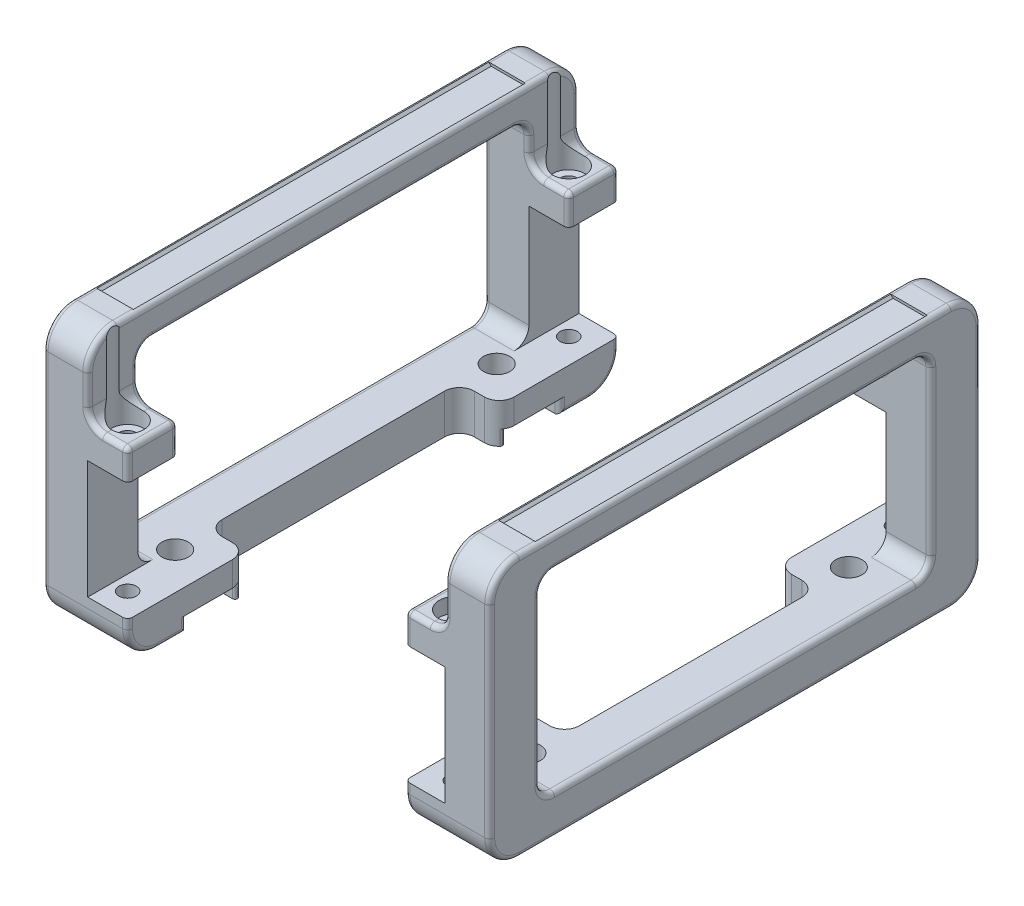
from build123d import *

# Parameters (mm, degrees)
EXTRUDE_1_DEPTH          = 49.5
EXTRUDE_1_DEPTH_BACK     = 49.5
SKETCH_3_W               = 9
SKETCH_3_H               = 23.8
SKETCH_4_W               = 9
SKETCH_4_H               = 10.1
SKETCH_4_H_2             = 78.8
SKETCH_4_W_2             = 8.03
SKETCH_4_R               = 1.75
EXTRUDE_2_DEPTH          = 6
MOVE_START               = -19.9
MOVE_FACE_1_OUTLINE_R    = 1.75
MOVE_FACE_1_DEPTH        = 2
SKETCH_5_W               = 99
SKETCH_5_H               = 15
EXTRUDE_2010_DEPTH       = 9
SKETCH_6_W               = 78.8
SKETCH_6_H               = 38.8
CUT_EXTRUDE_1_DEPTH      = 62.827832729
EXTRUDE_START            = -8
SKETCH_10_W              = 8.03
SKETCH_10_H              = 14
EXTRUDE_4_DEPTH          = 8
SKETCH_11_R              = 5.2
CUT_EXTRUDE_4_DEPTH      = 3
SKETCH_12_R              = 2.65
CUT_EXTRUDE_5_DEPTH      = 81.51266981
SKETCH_13_W              = 6.4
SKETCH_13_H              = 79
CUT_EXTRUDE_6_DEPTH      = 0.5
FILLET_START             = -46
FILLET_1_DEPTH           = 18.03
FILLET_2_R               = 3
FILLET_5_R               = 3
FILLET_3_R               = 1
FILLET_6_R               = 0.5
CUT_EXTRUDE_2_DEPTH      = 77.838076612
CUT_EXTRUDE_2_DEPTH_BACK = 3
SKETCH_8_R               = 3.25
CUT_EXTRUDE_START        = -5
SKETCH_9_R               = 3.25
CUT_EXTRUDE_3_DEPTH      = 5
CHAMFER_1_SIZE           = 0.5


with BuildPart() as part:
    # ｽｹｯﾁ3 → ﾎﾞｽ - 押し出し1 (new, two sides: drawn at the far end of the back side and taken through both)
    with BuildSketch(Plane.XY.offset(-EXTRUDE_1_DEPTH_BACK)):
        with Locations((-40.5, 0)):
            Rectangle(SKETCH_3_W, SKETCH_3_H)
    extrude(amount=EXTRUDE_1_DEPTH + EXTRUDE_1_DEPTH_BACK)

    # ｽｹｯﾁ4 → ﾎﾞｽ - 押し出し2 (add)
    # profile 1 of 5: a face of its own
    with BuildSketch(Plane(origin=(0, 11.9, 0), x_dir=(1, 0, 0), z_dir=(0, 1, 0))):
        with Locations((-40.5, 44.45)):
            Rectangle(SKETCH_4_W, SKETCH_4_H)
    # profile 2 of 5: a face of its own
    with BuildSketch(Plane(origin=(0, 11.9, 0), x_dir=(1, 0, 0), z_dir=(0, 1, 0))):
        with Locations((-40.5, 0)):
            Rectangle(SKETCH_4_W, SKETCH_4_H_2)
    # profile 3 of 5: a face of its own
    with BuildSketch(Plane(origin=(0, 11.9, 0), x_dir=(1, 0, 0), z_dir=(0, 1, 0))):
        with Locations((-40.5, -44.45)):
            Rectangle(SKETCH_4_W, SKETCH_4_H)
    # profile 4 of 5: a face of its own
    with BuildSketch(Plane(origin=(0, 11.9, 0), x_dir=(1, 0, 0), z_dir=(0, 1, 0))):
        with Locations((-31.985, 44.45)):
            Rectangle(SKETCH_4_W_2, SKETCH_4_H)
        with Locations(Location((-33.02, 44.45, 0), (0, 0, 180))):
            Circle(SKETCH_4_R, mode=Mode.SUBTRACT)
    # profile 5 of 5: a face of its own
    with BuildSketch(Plane(origin=(0, 11.9, 0), x_dir=(1, 0, 0), z_dir=(0, 1, 0))):
        with Locations((-31.985, -44.45)):
            Rectangle(SKETCH_4_W_2, SKETCH_4_H)
        with Locations(Location((-33.02, -44.45, 0), (0, 0, 180))):
            Circle(SKETCH_4_R, mode=Mode.SUBTRACT)
    extrude_2 = extrude(amount=EXTRUDE_2_DEPTH)

    # ﾐﾗｰ1: ﾎﾞｽ - 押し出し2 across plane
    add(extrude_2.mirror(Plane.ZX))

    # Move Face 1: read off the stored shape, not the designer's step
    # Move Face 1 outline → Move Face 1 (add)
    with BuildSketch(Plane(origin=(0, 0, 0), x_dir=(1, 0, 0), z_dir=(0, 1, 0)).offset(MOVE_START)):
        Polygon((-27.97, 39.4), (-27.97, 49.5), (-45, 49.5), (-45, -49.5), (-27.97, -49.5), (-27.97, -39.4), (-36, -39.4), (-36, 39.4), align=None)
        with Locations((-33.02, 44.45)):
            Circle(MOVE_FACE_1_OUTLINE_R, mode=Mode.SUBTRACT)
        with Locations((-33.02, -44.45)):
            Circle(MOVE_FACE_1_OUTLINE_R, mode=Mode.SUBTRACT)
    extrude(amount=MOVE_FACE_1_DEPTH)

    # ｽｹｯﾁ5 → Extrude 2010 (add)
    with BuildSketch(Plane.ZY.offset(45)):
        with Locations((0, 25.4)):
            Rectangle(SKETCH_5_W, SKETCH_5_H)
    extrude(amount=-EXTRUDE_2010_DEPTH)

    # ｽｹｯﾁ6 → ｶｯﾄ - 押し出し1 (cut, through all)
    with BuildSketch(Plane.ZY.offset(45)):
        with Locations((0, 7.5)):
            Rectangle(SKETCH_6_W, SKETCH_6_H)
    extrude(amount=-CUT_EXTRUDE_1_DEPTH, mode=Mode.SUBTRACT)

    # ｽｹｯﾁ10 → ﾎﾞｽ - 押し出し4 (add)
    with BuildSketch(Plane.XZ.offset(19.9).offset(EXTRUDE_START)):
        with Locations((-31.985, -32.4)):
            Rectangle(SKETCH_10_W, SKETCH_10_H)
        with Locations((-31.985, 32.4)):
            Rectangle(SKETCH_10_W, SKETCH_10_H)
    extrude(amount=EXTRUDE_4_DEPTH)

    # ｽｹｯﾁ11 → ｶｯﾄ - 押し出し4 (cut)
    with BuildSketch(Plane.XZ.offset(19.9)):
        with BuildLine():
            ThreePointArc((-30.285, -32.4), (-31.808044738, -36.076955262), (-35.485, -37.6))
            Line((-35.485, -37.6), (-27.97, -37.6))
            Line((-27.97, -37.6), (-27.97, -27.2))
            Line((-27.97, -27.2), (-35.485, -27.2))
            ThreePointArc((-35.485, -27.2), (-31.808044738, -28.723044738), (-30.285, -32.4))
        make_face()
        with BuildLine():
            ThreePointArc((-35.485, -27.2), (-40.685, -32.4), (-35.485, -37.6))
            Line((-35.485, -37.6), (-35.485, -27.2))
        make_face()
        with BuildLine():
            Line((-35.485, -27.2), (-35.485, -37.6))
            ThreePointArc((-35.485, -37.6), (-31.808044738, -36.076955262), (-30.285, -32.4))
            ThreePointArc((-30.285, -32.4), (-31.808044738, -28.723044738), (-35.485, -27.2))
        make_face()
        with Locations((-35.485, 32.4)):
            Circle(SKETCH_11_R)
        with BuildLine():
            ThreePointArc((-30.285, 32.4), (-31.808044738, 36.076955262), (-35.485, 37.6))
            Line((-35.485, 37.6), (-35.485, 27.2))
            ThreePointArc((-35.485, 27.2), (-31.808044738, 28.723044738), (-30.285, 32.4))
        make_face()
        with BuildLine():
            Line((-35.485, 27.2), (-35.485, 37.6))
            ThreePointArc((-35.485, 37.6), (-40.685, 32.4), (-35.485, 27.2))
        make_face()
        with BuildLine():
            Line((-27.97, 37.6), (-35.485, 37.6))
            ThreePointArc((-35.485, 37.6), (-31.808044738, 36.076955262), (-30.285, 32.4))
            ThreePointArc((-30.285, 32.4), (-31.808044738, 28.723044738), (-35.485, 27.2))
            Line((-35.485, 27.2), (-27.97, 27.2))
            Line((-27.97, 27.2), (-27.97, 37.6))
        make_face()
    extrude(amount=-CUT_EXTRUDE_4_DEPTH, mode=Mode.SUBTRACT)

    # ｽｹｯﾁ12 → ｶｯﾄ - 押し出し5 (cut, through all)
    with BuildSketch(Plane(origin=(0, -11.9, 0), x_dir=(1, 0, 0), z_dir=(0, 1, 0))):
        with Locations(Location((-35.485, -32.4, 0), (0, 0, 180))):
            Circle(SKETCH_12_R)
        with Locations(Location((-35.485, 32.4, 0), (0, 0, 180))):
            Circle(SKETCH_12_R)
    extrude(amount=-CUT_EXTRUDE_5_DEPTH, mode=Mode.SUBTRACT)

    # ｽｹｯﾁ13 → ｶｯﾄ - 押し出し6 (cut)
    with BuildSketch(Plane(origin=(0, 32.9, 0), x_dir=(1, 0, 0), z_dir=(0, 1, 0))):
        with Locations((-40.5, 0)):
            Rectangle(SKETCH_13_W, SKETCH_13_H)
    extrude(amount=-CUT_EXTRUDE_6_DEPTH, mode=Mode.SUBTRACT)

    # ﾌｨﾚｯﾄ1: read off the stored shape, not the designer's step
    # ﾌｨﾚｯﾄ1 outline → ﾌｨﾚｯﾄ1 (cut)
    with BuildSketch(Plane.YZ.offset(FILLET_START)):
        with BuildLine():
            ThreePointArc((-13.9, -49.5), (-18.142640687, -47.742640687), (-19.9, -43.5))
            Line((-19.9, -43.5), (-19.9, -49.5))
            Line((-19.9, -49.5), (-13.9, -49.5))
        make_face()
        with BuildLine():
            Line((-19.9, 49.5), (-19.9, 43.5))
            ThreePointArc((-19.9, 43.5), (-18.142640687, 47.742640687), (-13.9, 49.5))
            Line((-13.9, 49.5), (-19.9, 49.5))
        make_face()
        with BuildLine():
            ThreePointArc((32.9, -43.5), (31.142640687, -47.742640687), (26.9, -49.5))
            Line((26.9, -49.5), (32.9, -49.5))
            Line((32.9, -49.5), (32.9, -43.5))
        make_face()
        with BuildLine():
            Line((32.9, 49.5), (26.9, 49.5))
            ThreePointArc((26.9, 49.5), (31.142640687, 47.742640687), (32.9, 43.5))
            Line((32.9, 43.5), (32.9, 49.5))
        make_face()
    extrude(amount=FILLET_1_DEPTH, mode=Mode.SUBTRACT)

    # ﾌｨﾚｯﾄ2
    # the kernel refuses this fillet: 3 mm, written as the material it adds along each edge
    with BuildSketch(Plane(origin=(-36, 17.9, -49.5), x_dir=(1, 0, 0), z_dir=(0, 0, 1))) as fillet_2_piece_1_section:
        with BuildLine():
            CenterArc((FILLET_2_R, FILLET_2_R), FILLET_2_R, 180, 90)
            Line((0, FILLET_2_R), (0, 0))
            Line((0, 0), (FILLET_2_R, 0))
        make_face()
    fillet_2_piece_1 = extrude(amount=10.1, mode=Mode.PRIVATE)
    fillet_2_piece_1 = fillet_2_piece_1 - Plane(origin=(-33.02, 17.9, -44.45), x_dir=(-1, 0, 0), z_dir=(0, -1, 0)) * Cylinder(1.75, 33, mode=Mode.PRIVATE)
    add(fillet_2_piece_1)
    with BuildSketch(Plane(origin=(-36, 17.9, 39.4), x_dir=(0, 1, 0), z_dir=(0, 0, 1))) as fillet_2_piece_2_section:
        with BuildLine():
            CenterArc((FILLET_2_R, -FILLET_2_R), FILLET_2_R, 90, 90)
            Line((0, -FILLET_2_R), (0, 0))
            Line((0, 0), (FILLET_2_R, 0))
        make_face()
    fillet_2_piece_2 = extrude(amount=10.1, mode=Mode.PRIVATE)
    fillet_2_piece_2 = fillet_2_piece_2 - Plane(origin=(-33.02, 17.9, 44.45), x_dir=(-1, 0, 0), z_dir=(0, -1, 0)) * Cylinder(1.75, 33, mode=Mode.PRIVATE)
    add(fillet_2_piece_2)

    # ﾌｨﾚｯﾄ5
    fillet_5_edges = [part.edges().sort_by_distance(p)[0] for p in [
        (-40.5, 26.9, -39.4),
        (-40.5, 26.9, 39.4),
        (-40.5, -11.9, -39.4),
        (-40.5, -11.9, 39.4),
        (-36, -15.9, -25.4),
        (-36, -15.9, 25.4),
        (-27.97, -15.9, 25.4),
        (-27.97, -15.9, -25.4),
    ]]
    fillet(fillet_5_edges, radius=FILLET_5_R)

    # ﾌｨﾚｯﾄ3
    fillet_3_edges = [part.edges().sort_by_distance(p)[0] for p in [
        (-27.97, -18.4, -37.6),
        (-27.97, -18.4, 37.6),
        (-45, 6.5, -49.5),
        (-27.97, -12.9, -49.5),
        (-45, 6.5, 49.5),
        (-45, 32.9, 0),
        (-45, -19.9, 0),
        (-45, 31.142640687, 47.742640687),
        (-45, 31.142640687, -47.742640687),
        (-45, -18.142640687, 47.742640687),
        (-45, -18.142640687, -47.742640687),
        (-27.97, -19.9, 40.55),
        (-27.97, -19.9, -40.55),
        (-27.97, -18.142640687, -47.742640687),
        (-27.97, -12.9, 49.5),
        (-36, 23.9, 49.5),
        (-27.97, -18.142640687, 47.742640687),
        (-36, 32.9, 0),
        (-36, 31.142640687, 47.742640687),
        (-36, 31.142640687, -47.742640687),
        (-27.97, 14.9, 49.5),
        (-27.97, 14.9, 39.4),
        (-36, 23.9, -49.5),
        (-36, 22.4, 39.4),
        (-30.485, 17.9, 49.5),
        (-30.485, 17.9, 39.4),
        (-30.485, 17.9, -39.4),
        (-35.121320344, 18.778679656, 39.4),
        (-35.121320344, 18.778679656, 49.5),
        (-27.97, 17.9, -44.45),
        (-35.121320344, 18.778679656, -49.5),
        (-35.121320344, 18.778679656, -39.4),
        (-27.97, 14.9, -39.4),
        (-27.97, 14.9, -49.5),
        (-45, -11.9, 0),
        (-27.97, 17.9, 44.45),
        (-36, 22.4, -39.4),
        (-45, 7.5, -39.4),
        (-45, 7.5, 39.4),
        (-45, 26.9, 0),
        (-36, 26.9, 0),
        (-30.485, 17.9, -49.5),
        (-45, -11.021320344, -38.521320344),
        (-45, -11.021320344, 38.521320344),
        (-45, 26.021320344, -38.521320344),
        (-36, 26.021320344, -38.521320344),
        (-45, 26.021320344, 38.521320344),
        (-36, 26.021320344, 38.521320344),
    ]]
    fillet(fillet_3_edges, radius=FILLET_3_R)

    # ﾌｨﾚｯﾄ6
    fillet_6_edges = [part.edges().sort_by_distance(p)[0] for p in [
        (-28.220454583, -18.4, 27.2),
        (-28.220454583, -18.4, -27.2),
    ]]
    fillet(fillet_6_edges, radius=FILLET_6_R)

    # ｽｹｯﾁ8 → ｶｯﾄ - 押し出し2 (cut, two sides: drawn at the far end of the back side and taken through both)
    with BuildSketch(Plane(origin=(0, 17.9, 0), x_dir=(1, 0, 0), z_dir=(0, 1, 0)).offset(-CUT_EXTRUDE_2_DEPTH_BACK)):
        with Locations(Location((-33.02, 44.45, 0), (0, 0, 89.647408349))):
            Circle(SKETCH_8_R)
        with Locations(Location((-33.02, -44.45, 0), (0, 0, 89.647408349))):
            Circle(SKETCH_8_R)
    extrude(amount=CUT_EXTRUDE_2_DEPTH + CUT_EXTRUDE_2_DEPTH_BACK, mode=Mode.SUBTRACT)

    # ｽｹｯﾁ9 → ｶｯﾄ - 押し出し3 (cut)
    with BuildSketch(Plane.XZ.offset(19.9).offset(CUT_EXTRUDE_START)):
        with Locations(Location((-33.02, 44.45, 0), (0, 0, 270.352591651))):
            Circle(SKETCH_9_R)
        with Locations(Location((-33.02, -44.45, 0), (0, 0, 270.352591651))):
            Circle(SKETCH_9_R)
    extrude(amount=CUT_EXTRUDE_3_DEPTH, mode=Mode.SUBTRACT)

    # 面取り1
    # the kernel refuses this chamfer: 0.5 mm, written as the material it takes off along each edge
    with BuildSketch(Plane(origin=(-37.3, 32.9, 39.5), x_dir=(1, 0, 0), z_dir=(0, 0, -1))) as chamfer_1_piece_1_section:
        Polygon((CHAMFER_1_SIZE, 0), (0, CHAMFER_1_SIZE), (0, 0), align=None)
    chamfer_1_piece_1 = extrude(amount=79, mode=Mode.PRIVATE)
    chamfer_1_piece_1 = split(chamfer_1_piece_1, bisect_by=Plane(origin=(-37.3, 32.4, 39.5), z_dir=(0, 1, 0)), keep=Keep.TOP, mode=Mode.PRIVATE)
    add(chamfer_1_piece_1, mode=Mode.SUBTRACT)
    with BuildSketch(Plane(origin=(-43.7, 32.9, -39.5), x_dir=(-1, 0, 0), z_dir=(0, 0, 1))) as chamfer_1_piece_2_section:
        Polygon((CHAMFER_1_SIZE, 0), (0, CHAMFER_1_SIZE), (0, 0), align=None)
    chamfer_1_piece_2 = extrude(amount=79, mode=Mode.PRIVATE)
    chamfer_1_piece_2 = split(chamfer_1_piece_2, bisect_by=Plane(origin=(-43.7, 32.4, -39.5), z_dir=(0, 1, 0)), keep=Keep.TOP, mode=Mode.PRIVATE)
    add(chamfer_1_piece_2, mode=Mode.SUBTRACT)


with BuildPart() as body_2:
    # ﾐﾗｰ3: mirrored copy
    add(part.part.mirror(Plane(origin=(0, 0, 0), x_dir=(0, 0, 1), z_dir=(1, 0, 0))))


solid = Compound([part.part, body_2.part])
